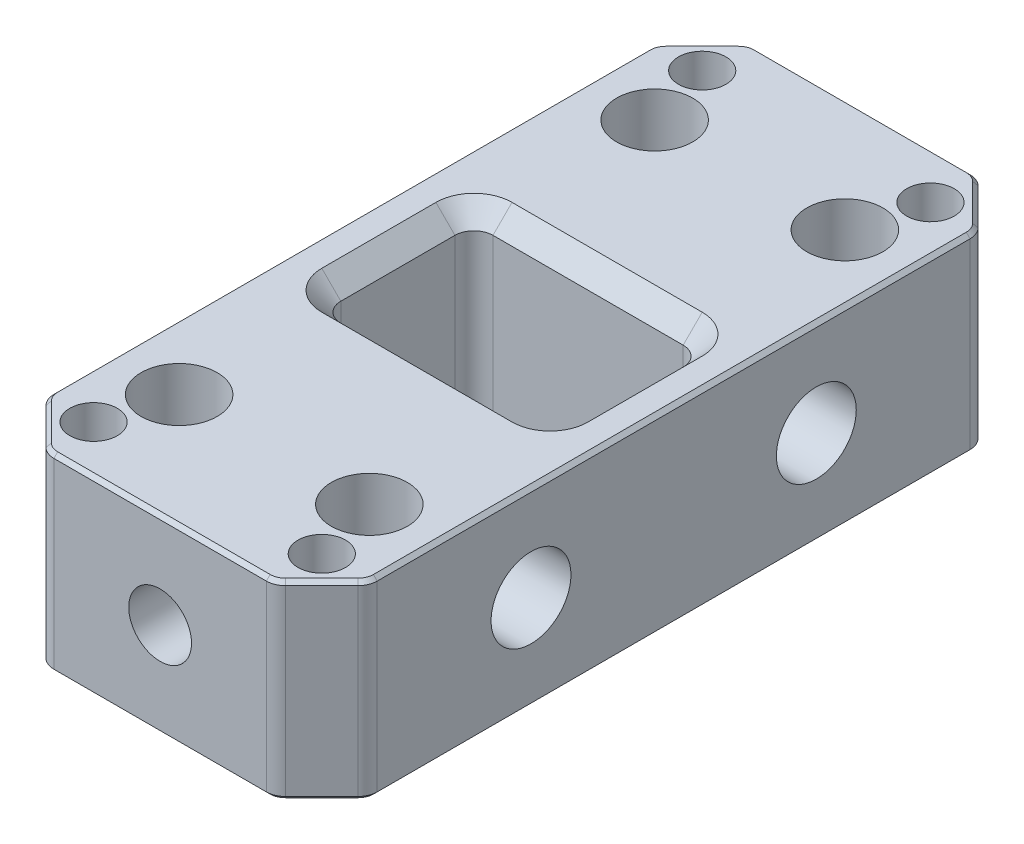
from build123d import *
from OCP.BRepFilletAPI import BRepFilletAPI_MakeChamfer

# Parameters (mm, degrees)
SKETCH_1_W          = 17
SKETCH_1_H          = 37
EXTRUDE_1_DEPTH     = 5
SKETCH_2_R          = 1.5
CUT_EXTRUDE_1_DEPTH = 26.617376915
SKETCH_3_R          = 1.6
CUT_EXTRUDE_3_DEPTH = 8
SKETCH_4_R          = 1
SKETCH_4_W          = 12
SKETCH_4_H          = 8
CUT_EXTRUDE_4_DEPTH = 23.682592444
CHAMFER_1_SIZE      = 2.5
SKETCH_6_R          = 2
CUT_EXTRUDE_5_DEPTH = 23.682592444
FILLET_1_R          = 1
HOLE_WIZARD_M3_1_D  = 2.5
CHAMFER_2_SIZE      = 0.2
CHAMFER_2_SIZE2     = 0.584574438
CHAMFER_3_SIZE      = 0.2
CHAMFER_4_SIZE      = 1
HOLE_WIZARD_M5_1_D  = 4.2


# Read off the part's stored shape, not the designer's step: M4 螺纹孔1
with BuildPart() as part:
    # 草图1 → 凸台-拉伸1 (new, symmetric)
    with BuildSketch(Plane(origin=(0, 0, 0), x_dir=(1, 0, 0), z_dir=(0, 1, 0))):
        Rectangle(SKETCH_1_W, SKETCH_1_H)
    extrude(amount=EXTRUDE_1_DEPTH, both=True)

    # 草图2 → 切除-拉伸1 (cut, through all)
    with BuildSketch(Plane(origin=(8.5, 0, 0), x_dir=(0, 0, -1), z_dir=(1, 0, 0))):
        with Locations((-7.5, 0)):
            Circle(SKETCH_2_R)
        with Locations((7.5, 0)):
            Circle(SKETCH_2_R)
    extrude(amount=-CUT_EXTRUDE_1_DEPTH, mode=Mode.SUBTRACT)

    # 草图3 → 切除-拉伸3 (cut)
    with BuildSketch(Plane(origin=(0, 0, -18.5), x_dir=(-1, 0, 0), z_dir=(0, 0, -1))):
        Circle(SKETCH_3_R)
    cut_extrude_3 = extrude(amount=-CUT_EXTRUDE_3_DEPTH, mode=Mode.SUBTRACT)

    # 草图4 → 切除-拉伸4 (cut, through all)
    with BuildSketch(Plane(origin=(0, 5, 0), x_dir=(1, 0, 0), z_dir=(0, 1, 0))):
        with Locations(Location((-6, -16, 0), (0, 0, 270))):
            Circle(SKETCH_4_R)
        with Locations(Location((6, -16, 0), (0, 0, 270))):
            Circle(SKETCH_4_R)
        with Locations(Location((6, 16, 0), (0, 0, 270))):
            Circle(SKETCH_4_R)
        with Locations(Location((-6, 16, 0), (0, 0, 270))):
            Circle(SKETCH_4_R)
        Rectangle(SKETCH_4_W, SKETCH_4_H)
    extrude(amount=-CUT_EXTRUDE_4_DEPTH, mode=Mode.SUBTRACT)

    # 镜向1: 切除-拉伸3 across plane
    add(cut_extrude_3.mirror(Plane.XY), mode=Mode.SUBTRACT)

    # 倒角1
    chamfer_1_edges = [part.edges().sort_by_distance(p)[0] for p in [
        (8.5, 0, 18.5),
        (-8.5, 0, 18.5),
        (-8.5, 0, -18.5),
        (8.5, 0, -18.5),
    ]]
    chamfer(chamfer_1_edges, length=CHAMFER_1_SIZE)

    # 草图6 → 切除-拉伸5 (cut, through all)
    with BuildSketch(Plane(origin=(0, 5, 0), x_dir=(1, 0, 0), z_dir=(0, 1, 0))):
        with Locations(Location((5, 12.5, 0), (0, 0, 270))):
            Circle(SKETCH_6_R)
        with Locations(Location((-5, 12.5, 0), (0, 0, 270))):
            Circle(SKETCH_6_R)
        with Locations(Location((5, -12.5, 0), (0, 0, 270))):
            Circle(SKETCH_6_R)
        with Locations(Location((-5, -12.5, 0), (0, 0, 270))):
            Circle(SKETCH_6_R)
    extrude(amount=-CUT_EXTRUDE_5_DEPTH, mode=Mode.SUBTRACT)

    # 圆角1
    fillet_1_edges = [part.edges().sort_by_distance(p)[0] for p in [
        (6, 0, -4),
        (6, 0, 4),
        (-6, 0, 4),
        (-6, 0, -4),
        (-8.5, 0, 16),
        (-8.5, 0, -16),
        (6, 0, -18.5),
        (-6, 0, -18.5),
        (8.5, 0, 16),
        (8.5, 0, -16),
        (-6, 0, 18.5),
        (6, 0, 18.5),
    ]]
    fillet(fillet_1_edges, radius=FILLET_1_R)

    # M4 螺纹孔1 outline → M4 螺纹孔1 (revolve, cut)
    with BuildSketch(Plane.XZ):
        Polygon((0, -9.508579979), (0, -10.5), (1.6, -10.5), (1.6, -18.5), (1.65, -18.5), (1.65, -10.5), align=None)
        Polygon((0, 10.5), (0, 9.508579979), (1.65, 10.5), (1.65, 18.5), (1.6, 18.5), (1.6, 10.5), align=None)
    revolve(axis=Axis((0, 0, 0), (0, 0, 1)), mode=Mode.SUBTRACT)

    # M3 螺纹孔1 (through all)
    with Locations(Plane(origin=(0, 5, 0), x_dir=(1, 0, 0), z_dir=(0, 1, 0))):
        with Locations((-6, -16), (6, -16), (6, 16), (-6, 16)):
            Hole(HOLE_WIZARD_M3_1_D / 2)

    # 倒角2: one chamfer whose edges measure the first distance from different faces: ONE call of the kernel's chamfer builder (chamfer() names one face for all edges)
    chamfer_2_edges_1 = [part.edges().sort_by_distance(p)[0] for p in [
        (-8.5, 5, 0),
        (0, 5, -18.5),
        (-7.25, 5, -17.25),
        (-7.25, 5, 17.25),
        (0, 5, 18.5),
        (7.25, 5, 17.25),
        (8.5, 5, 0),
        (7.25, 5, -17.25),
        (5.96846987, 5, 18.423879533),
        (-8.423879533, 5, -15.96846987),
        (-5.96846987, 5, -18.423879533),
        (5.96846987, 5, -18.423879533),
        (8.423879533, 5, -15.96846987),
        (8.423879533, 5, 15.96846987),
        (-5.96846987, 5, 18.423879533),
        (-8.423879533, 5, 15.96846987),
        (-1.65, 0, -18.5),
    ]]
    chamfer_2_edges_2 = [part.edges().sort_by_distance(p)[0] for p in [
        (-1.65, 0, -10.5),
    ]]
    chamfer_2_side_2 = [part.faces().sort_by_distance(p)[0] for p in [
        (-1.65, 0, -14.5),
    ]]
    chamfer_2 = BRepFilletAPI_MakeChamfer(part.part.solid().wrapped)
    for e in chamfer_2_edges_1:
        chamfer_2.Add(CHAMFER_2_SIZE, e.wrapped)
    for e in chamfer_2_edges_2:
        chamfer_2.Add(CHAMFER_2_SIZE, CHAMFER_2_SIZE2, e.wrapped, chamfer_2_side_2[0].wrapped)  # the first distance lies on this face
    add(Compound.cast(chamfer_2.Shape()), mode=Mode.REPLACE)

    # 倒角3
    chamfer_3_edges = [part.edges().sort_by_distance(p)[0] for p in [
        (-8.5, -5, 0),
        (-7.25, -5, 17.25),
        (-7.25, -5, -17.25),
        (0, -5, -18.5),
        (7.25, -5, -17.25),
        (8.5, -5, 0),
        (7.25, -5, 17.25),
        (0, -5, 18.5),
        (5.96846987, -5, 18.423879533),
        (-8.423879533, -5, -15.96846987),
        (-5.96846987, -5, -18.423879533),
        (5.96846987, -5, -18.423879533),
        (8.423879533, -5, -15.96846987),
        (8.423879533, -5, 15.96846987),
        (-5.96846987, -5, 18.423879533),
        (-8.423879533, -5, 15.96846987),
    ]]
    chamfer(chamfer_3_edges, length=CHAMFER_3_SIZE)

    # 倒角4
    chamfer_4_edges = [part.edges().sort_by_distance(p)[0] for p in [
        (6, 5, 0),
        (0, 5, 4),
        (-6, 5, 0),
        (0, 5, -4),
        (0, -5, 4),
        (6, -5, 0),
        (0, -5, -4),
        (-6, -5, 0),
        (-5.707106781, 5, 3.707106781),
        (-5.707106781, -5, 3.707106781),
        (-5.707106781, 5, -3.707106781),
        (-5.707106781, -5, -3.707106781),
        (5.707106781, 5, -3.707106781),
        (5.707106781, -5, -3.707106781),
        (5.707106781, 5, 3.707106781),
        (5.707106781, -5, 3.707106781),
    ]]
    chamfer(chamfer_4_edges, length=CHAMFER_4_SIZE)

    # M5 螺纹孔1 (through all)
    with Locations(Plane(origin=(8.5, 0, 0), x_dir=(0, 0, -1), z_dir=(1, 0, 0))):
        with Locations((-7.5, 0), (7.5, 0)):
            Hole(HOLE_WIZARD_M5_1_D / 2)


solid = part.part
